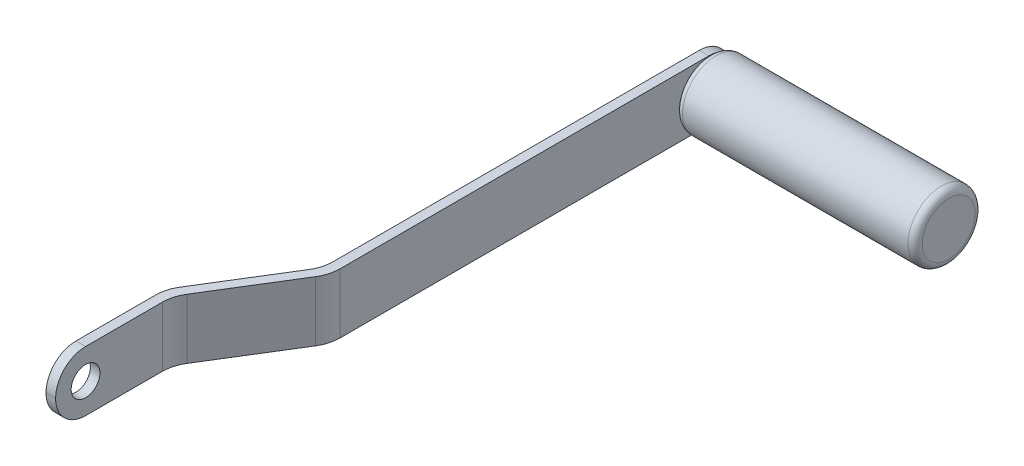
from build123d import *

# Parameters (mm, degrees)
EXTRUDE_THIN1_DEPTH = 25
FILLET1_R           = 15
FILLET2_R           = 12.5
SKETCH2_R           = 6
CUT_EXTRUDE1_DEPTH  = 10
SKETCH3_R           = 14
BOSS_EXTRUDE1_DEPTH = 100
FILLET3_R           = 3


with BuildPart() as part:
    # Sketch1 → Extrude-Thin1 (new body)
    with BuildSketch(Plane(origin=(0, 0, 0), x_dir=(1, 0, 0), z_dir=(0, 1, 0))):
        Polygon((0, 0), (0, 50), (25, 90.499181326), (25, 260), (29, 260), (29, 89.364018992), (4, 48.864837665), (4, 0), align=None)
    extrude(amount=EXTRUDE_THIN1_DEPTH)

    # Fillet1
    fillet1_edges = [part.edges().sort_by_distance(p)[0] for p in [
        (29, 12.5, -89.364018992),
        (4, 12.5, -48.864837665),
        (0, 12.5, -50),
        (25, 12.5, -90.499181326),
    ]]
    fillet(fillet1_edges, radius=FILLET1_R)

    # Fillet2
    fillet2_edges = [part.edges().sort_by_distance(p)[0] for p in [
        (27, 0, -260),
        (27, 25, -260),
        (2, 0, 0),
        (2, 25, 0),
    ]]
    fillet(fillet2_edges, radius=FILLET2_R - 0.0001)  # a hair under: the kernel refuses the full size

    # Sketch2 → Cut-Extrude1 (cut)
    with BuildSketch(Plane.ZY):
        with Locations((-12.5, 12.5)):
            Circle(SKETCH2_R)
    extrude(amount=-CUT_EXTRUDE1_DEPTH, mode=Mode.SUBTRACT)


with BuildPart() as body_2:
    # Sketch3 → Boss-Extrude1 (new body)
    with BuildSketch(Plane(origin=(29, 0, 0), x_dir=(0, 0, -1), z_dir=(1, 0, 0))):
        with Locations((247.5, 12.5)):
            Circle(SKETCH3_R)
    extrude(amount=BOSS_EXTRUDE1_DEPTH)

    # Fillet3
    fillet3_edges = [body_2.edges().sort_by_distance(p)[0] for p in [
        (29, 12.5, -233.5),
        (129, 12.5, -233.5),
    ]]
    fillet(fillet3_edges, radius=FILLET3_R)


solid = Compound([part.part, body_2.part])
